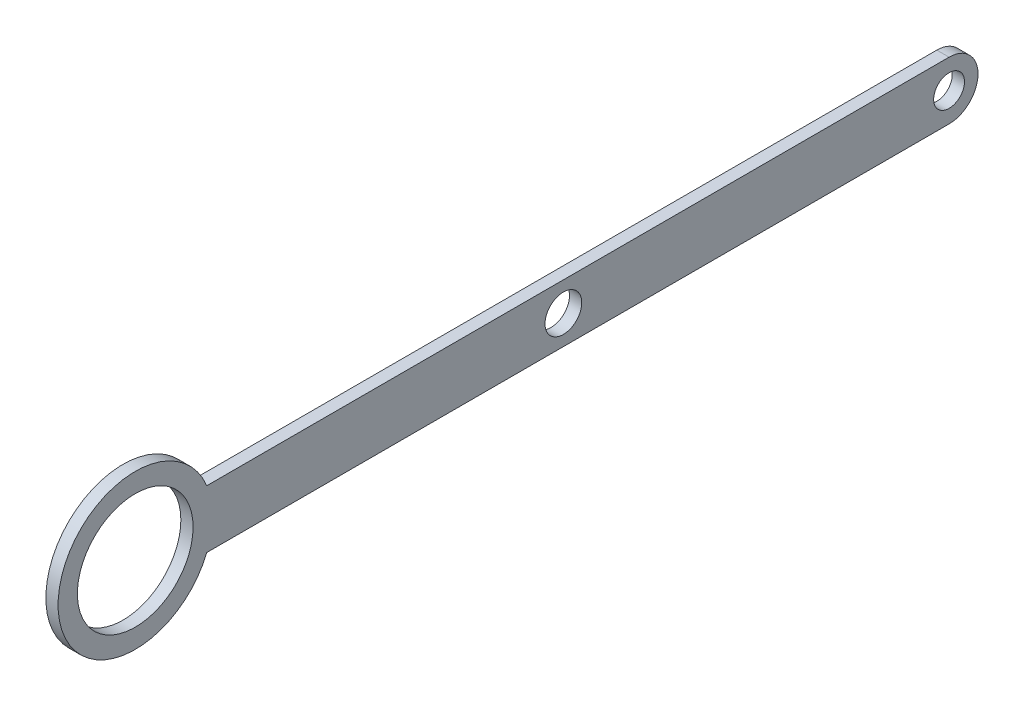
from build123d import *

# Parameters (mm, degrees)
SKETCH1_R           = 4.7625
SKETCH1_R_2         = 4
SKETCH1_R_3         = 15
BOSS_EXTRUDE1_DEPTH = 3.175


with BuildPart() as part:
    # Sketch1 → Boss-Extrude1 (new body)
    with BuildSketch(Plane(origin=(0, 0, 0), x_dir=(0, 0, -1), z_dir=(1, 0, 0))):
        with BuildLine():
            ThreePointArc((100, -7.5), (107.5, 0), (100, 7.5))
            Line((100, 7.5), (-92.459503782, 7.5))
            ThreePointArc((-92.459503782, 7.5), (-131, 0), (-92.459503782, -7.5))
            Line((-92.459503782, -7.5), (100, -7.5))
        make_face()
        Circle(SKETCH1_R, mode=Mode.SUBTRACT)
        with Locations((100, 0)):
            Circle(SKETCH1_R_2, mode=Mode.SUBTRACT)
        with Locations((-111, 0)):
            Circle(SKETCH1_R_3, mode=Mode.SUBTRACT)
    extrude(amount=BOSS_EXTRUDE1_DEPTH)


solid = part.part
